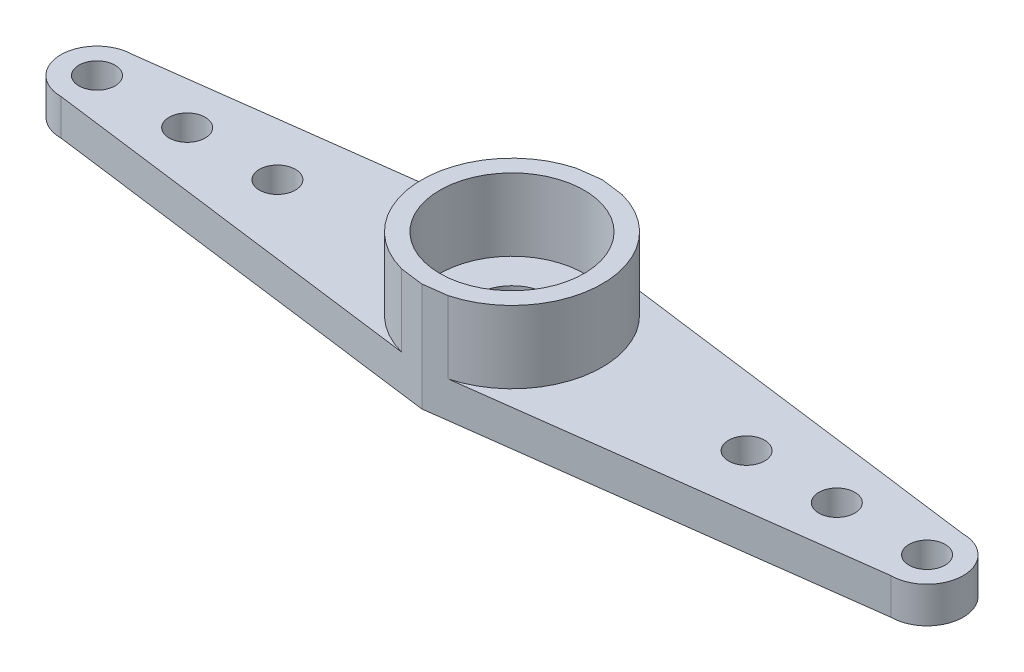
from build123d import *

# Parameters (mm, degrees)
SKETCH1_R           = 0.5
SKETCH1_R_2         = 1
BOSS_EXTRUDE1_DEPTH = 1
SKETCH1_4_R         = 2
BOSS_EXTRUDE2_DEPTH = 3


with BuildPart() as part:
    # Sketch1 → Boss-Extrude1 (new body)
    with BuildSketch(Plane(origin=(0, 0, 0), x_dir=(1, 0, 0), z_dir=(0, 1, 0))):
        with BuildLine():
            ThreePointArc((11.5, -1), (12.5, 0), (11.5, 1))
            Line((11.5, 1), (0, 2.5))
            Line((0, 2.5), (-11.5, 1))
            ThreePointArc((-11.5, 1), (-12.5, 0), (-11.5, -1))
            Line((-11.5, -1), (0, -2.5))
            Line((0, -2.5), (11.5, -1))
        make_face()
        with Locations((6.5, 0)):
            Circle(SKETCH1_R, mode=Mode.SUBTRACT)
        with Locations((9, 0)):
            Circle(SKETCH1_R, mode=Mode.SUBTRACT)
        with Locations((11.5, 0)):
            Circle(SKETCH1_R, mode=Mode.SUBTRACT)
        Circle(SKETCH1_R_2, mode=Mode.SUBTRACT)
        with Locations((-6.5, 0)):
            Circle(SKETCH1_R, mode=Mode.SUBTRACT)
        with Locations((-9, 0)):
            Circle(SKETCH1_R, mode=Mode.SUBTRACT)
        with Locations((-11.5, 0)):
            Circle(SKETCH1_R, mode=Mode.SUBTRACT)
    extrude(amount=BOSS_EXTRUDE1_DEPTH)

    # Sketch1<4> → Boss-Extrude2 (add)
    with BuildSketch(Plane(origin=(0, 0, 0), x_dir=(1, 0, 0), z_dir=(0, 1, 0))):
        with BuildLine():
            ThreePointArc((2.5, 0), (1.981559973, 1.524276902), (0.641263941, 2.416356877))
            Line((0.641263941, 2.416356877), (0, 2.5))
            Line((0, 2.5), (-0.641263941, 2.416356877))
            ThreePointArc((-0.641263941, 2.416356877), (-2.5, 0), (-0.641263941, -2.416356877))
            Line((-0.641263941, -2.416356877), (0, -2.5))
            Line((0, -2.5), (0.641263941, -2.416356877))
            ThreePointArc((0.641263941, -2.416356877), (1.981559973, -1.524276902), (2.5, 0))
        make_face()
        Circle(SKETCH1_4_R, mode=Mode.SUBTRACT)
    extrude(amount=BOSS_EXTRUDE2_DEPTH)


solid = part.part
